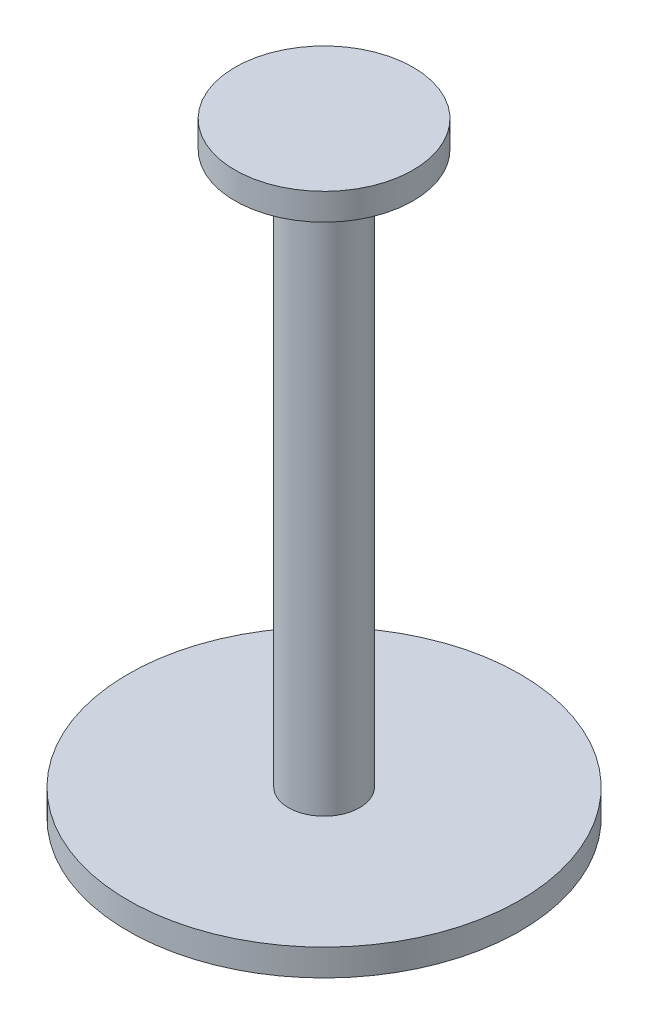
from build123d import *

# Parameters (mm, degrees)
THREAD1_PITCH = 1


with BuildPart() as part:
    # Sketch1 → Revolve1 (revolve)
    with BuildSketch(Plane.XY, mode=Mode.PRIVATE) as revolve1_sk:
        Polygon((0, 0), (4, 0), (4, 8), (22, 8), (22, 11), (4, 11), (4, 73), (10, 73), (10, 76), (0, 76), align=None)
    revolve(revolve1_sk.sketch.rotate(Axis((0, 0, 0), (0, 1, 0)), 90), axis=Axis((0, 0, 0), (0, 1, 0)))

    # Thread1: the profile of Thread Profile2 profile screwed along a right-hand helix of 10 turns, 8 arcs to a turn; built about Z, then put on its axis
    thread1_z = Axis((0, 0, 0), (0, 0, 1))
    thread1_corners = [(4.0003, 0, -0.000173205), (4.0003, 0, 0.875173202), (3.458734125, 0, 0.562499999), (3.458734125, 0, 0.312499999)]
    with BuildLine(mode=Mode.PRIVATE) as thread1_profile:
        Line(thread1_corners[0], thread1_corners[1])
        Line(thread1_corners[1], thread1_corners[2])
        Line(thread1_corners[2], thread1_corners[3])
        Line(thread1_corners[3], thread1_corners[0])
    thread1_cap = Face(thread1_profile.wire())
    thread1_turn_angles = [0, 22.5, 45, 67.5, 90, 112.5, 135, 157.5, 180, 202.5, 225, 247.5, 270, 292.5, 315, 337.5, 360]
    thread1_turn_weights = [1, 0.9238795325112867, 1, 0.9238795325112867, 1, 0.9238795325112867, 1, 0.9238795325112867, 1, 0.9238795325112867, 1, 0.9238795325112867, 1, 0.9238795325112867, 1, 0.9238795325112867, 1]
    thread1_turn_rails = [Edge.make_bspline([Vector(p[0], p[1], 0).rotate(thread1_z, thread1_turn_angles[k]) / thread1_turn_weights[k] + Vector(0, 0, p[2] + THREAD1_PITCH * thread1_turn_angles[k] / 360) for k in range(17)], [0, 0, 0, 1, 1, 2, 2, 3, 3, 4, 4, 5, 5, 6, 6, 7, 7, 8, 8, 8], 2, thread1_turn_weights) for p in thread1_corners]
    thread1_turn_sides = [Face.make_surface_from_curves(thread1_turn_rails[p[0]], thread1_turn_rails[p[1]]) for p in [(0, 1), (1, 2), (2, 3), (3, 0)]]
    thread1 = Plane(origin=(0, 0, 0), x_dir=(1, 0, 0), z_dir=(0, 1, 0)) * Solid(Shell([*[p.moved(Location((0, 0, THREAD1_PITCH * i))) for i in range(10) for p in thread1_turn_sides], thread1_cap, thread1_cap.rotate(thread1_z, 3600).moved(Location((0, 0, THREAD1_PITCH * 3600 / 360)))]))
    add(thread1, mode=Mode.SUBTRACT)


solid = part.part
